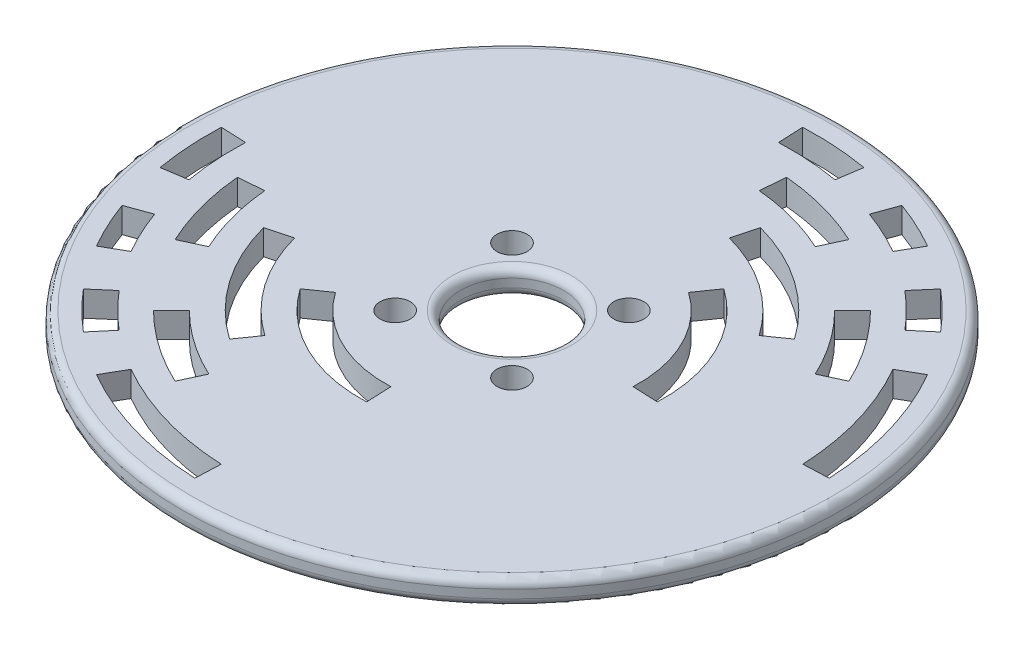
from build123d import *

# Parameters (mm, degrees)
SKETCH4_R           = 39
BOSS_EXTRUDE1_DEPTH = 3
CUT_EXTRUDE1_DEPTH  = 3
SKETCH1_R           = 6.096
SKETCH1_R_2         = 1.7859375
CUT_EXTRUDE3_DEPTH  = 3
FILLET1_R           = 1


with BuildPart() as part:
    # Sketch4 → Boss-Extrude1 (new body)
    with BuildSketch(Plane(origin=(0, 0, 0), x_dir=(1, 0, 0), z_dir=(0, 1, 0))):
        Circle(SKETCH4_R)
    extrude(amount=BOSS_EXTRUDE1_DEPTH)

    # Sketch3 → Cut-Extrude1 (cut)
    with BuildSketch(Plane(origin=(0, 0, 0), x_dir=(1, 0, 0), z_dir=(0, 1, 0))):
        with BuildLine():
            Line((32.968591312, 1.439439783), (35.965735977, 1.570297945))
            ThreePointArc((35.965735977, 1.570297945), (34.561794758, 10.073844505), (31.176914536, 18))
            Line((31.176914536, 18), (28.578838325, 16.5))
            ThreePointArc((28.578838325, 16.5), (31.681645195, 9.234357463), (32.968591312, 1.439439783))
        make_face()
        with BuildLine():
            Line((-1.570297945, 35.965735977), (-1.439439783, 32.968591312))
            ThreePointArc((-1.439439783, 32.968591312), (2.158303265, 32.929344467), (5.730389863, 32.498655849))
            Line((5.730389863, 32.498655849), (6.186823022, 35.464393705))
            ThreePointArc((6.186823022, 35.464393705), (2.321833751, 35.925048198), (-1.570297945, 35.965735977))
        make_face()
        with BuildLine():
            Line((12.31272516, 33.828934348), (11.28666473, 31.009856486))
            ThreePointArc((11.28666473, 31.009856486), (13.946402637, 29.908156972), (16.5, 28.578838325))
            Line((16.5, 28.578838325), (18, 31.176914536))
            ThreePointArc((18, 31.176914536), (15.214257423, 32.627080333), (12.31272516, 33.828934348))
        make_face()
        with BuildLine():
            Line((23.163459499, 27.558195587), (21.21199112, 25.279466623))
            ThreePointArc((21.21199112, 25.279466623), (23.334523779, 23.334523779), (25.279466623, 21.21199112))
            Line((25.279466623, 21.21199112), (27.577599952, 23.140353949))
            ThreePointArc((27.577599952, 23.140353949), (25.466509571, 25.445174203), (23.163459499, 27.558195587))
        make_face()
        with BuildLine():
            Line((-13.765834472, -19.659649063), (-12.045105163, -17.20219293))
            ThreePointArc((-12.045105163, -17.20219293), (-17.20219293, -12.045105163), (-20.284442352, -5.435199947))
            Line((-20.284442352, -5.435199947), (-23.182219831, -6.211657082))
            ThreePointArc((-23.182219831, -6.211657082), (-19.659649063, -13.765834472), (-13.765834472, -19.659649063))
        make_face()
        with BuildLine():
            Line((14.985723324, -0.65429081), (17.982867988, -0.785148973))
            ThreePointArc((17.982867988, -0.785148973), (16.143709348, 7.961196424), (10.324375854, 14.744736797))
            Line((10.324375854, 14.744736797), (8.603646545, 12.287280664))
            ThreePointArc((8.603646545, 12.287280664), (13.453091123, 6.634330353), (14.985723324, -0.65429081))
        make_face()
        with BuildLine():
            Line((-12.678547852, -27.189233611), (-11.410693067, -24.47031025))
            ThreePointArc((-11.410693067, -24.47031025), (-15.486563781, -22.117105196), (-19.091883092, -19.091883092))
            Line((-19.091883092, -19.091883092), (-21.213203436, -21.213203436))
            ThreePointArc((-21.213203436, -21.213203436), (-17.207293091, -24.574561329), (-12.678547852, -27.189233611))
        make_face()
        with BuildLine():
            Line((2.614672282, 29.885840943), (2.353205054, 26.897256848))
            ThreePointArc((2.353205054, 26.897256848), (6.988114218, 26.07999731), (11.410693067, 24.47031025))
            Line((11.410693067, 24.47031025), (12.678547852, 27.189233611))
            ThreePointArc((12.678547852, 27.189233611), (7.764571353, 28.977774789), (2.614672282, 29.885840943))
        make_face()
        with BuildLine():
            Line((21.213203436, 21.213203436), (19.091883092, 19.091883092))
            ThreePointArc((19.091883092, 19.091883092), (22.117105196, 15.486563781), (24.47031025, 11.410693067))
            Line((24.47031025, 11.410693067), (27.189233611, 12.678547852))
            ThreePointArc((27.189233611, 12.678547852), (24.574561329, 17.207293091), (21.213203436, 21.213203436))
        make_face()
        with BuildLine():
            Line((6.211657082, 23.182219831), (5.435199947, 20.284442352))
            ThreePointArc((5.435199947, 20.284442352), (12.045105163, 17.20219293), (17.20219293, 12.045105163))
            Line((17.20219293, 12.045105163), (19.659649063, 13.765834472))
            ThreePointArc((19.659649063, 13.765834472), (13.765834472, 19.659649063), (6.211657082, 23.182219831))
        make_face()
        with BuildLine():
            Line((-27.189233611, -12.678547852), (-24.47031025, -11.410693067))
            ThreePointArc((-24.47031025, -11.410693067), (-26.07999731, -6.988114218), (-26.897256848, -2.353205054))
            Line((-26.897256848, -2.353205054), (-29.885840943, -2.614672282))
            ThreePointArc((-29.885840943, -2.614672282), (-28.977774789, -7.764571353), (-27.189233611, -12.678547852))
        make_face()
        with BuildLine():
            Line((-14.744736797, -10.324375854), (-12.287280664, -8.603646545))
            ThreePointArc((-12.287280664, -8.603646545), (-6.634330353, -13.453091123), (0.65429081, -14.985723324))
            Line((0.65429081, -14.985723324), (0.785148973, -17.982867988))
            ThreePointArc((0.785148973, -17.982867988), (-7.961196424, -16.143709348), (-14.744736797, -10.324375854))
        make_face()
        with BuildLine():
            Line((-18, -31.176914536), (-16.5, -28.578838325))
            ThreePointArc((-16.5, -28.578838325), (-9.234357463, -31.681645195), (-1.439439783, -32.968591312))
            Line((-1.439439783, -32.968591312), (-1.570297945, -35.965735977))
            ThreePointArc((-1.570297945, -35.965735977), (-10.073844505, -34.561794758), (-18, -31.176914536))
        make_face()
        with BuildLine():
            Line((-23.140353949, -27.577599952), (-21.21199112, -25.279466623))
            ThreePointArc((-21.21199112, -25.279466623), (-23.334523779, -23.334523779), (-25.279466623, -21.21199112))
            Line((-25.279466623, -21.21199112), (-27.558195587, -23.163459499))
            ThreePointArc((-27.558195587, -23.163459499), (-25.445174203, -25.466509571), (-23.140353949, -27.577599952))
        make_face()
        with BuildLine():
            Line((-31.176914536, -18), (-28.578838325, -16.5))
            ThreePointArc((-28.578838325, -16.5), (-29.908156972, -13.946402637), (-31.009856486, -11.28666473))
            Line((-31.009856486, -11.28666473), (-33.828934348, -12.31272516))
            ThreePointArc((-33.828934348, -12.31272516), (-32.627080333, -15.214257423), (-31.176914536, -18))
        make_face()
        with BuildLine():
            Line((-35.464393705, -6.186823022), (-32.498655849, -5.730389863))
            ThreePointArc((-32.498655849, -5.730389863), (-32.929344467, -2.158303265), (-32.968591312, 1.439439783))
            Line((-32.968591312, 1.439439783), (-35.965735977, 1.570297945))
            ThreePointArc((-35.965735977, 1.570297945), (-35.925048198, -2.321833751), (-35.464393705, -6.186823022))
        make_face()
    extrude(amount=CUT_EXTRUDE1_DEPTH, mode=Mode.SUBTRACT)

    # Sketch1 → Cut-Extrude3 (cut)
    with BuildSketch(Plane(origin=(0, 0, 0), x_dir=(1, 0, 0), z_dir=(0, 1, 0))):
        Circle(SKETCH1_R)
        with Locations((6.914797213, 6.914797213)):
            Circle(SKETCH1_R_2)
        with Locations((6.914797213, -6.914797213)):
            Circle(SKETCH1_R_2)
        with Locations((-6.914797213, -6.914797213)):
            Circle(SKETCH1_R_2)
        with Locations((-6.914797213, 6.914797213)):
            Circle(SKETCH1_R_2)
    extrude(amount=CUT_EXTRUDE3_DEPTH, mode=Mode.SUBTRACT)

    # Fillet1
    fillet1_edges = [part.edges().sort_by_distance(p)[0] for p in [
        (-6.096, 0, 0),
        (-6.096, 3, 0),
        (-39, 3, 0),
        (-39, 0, 0),
    ]]
    fillet(fillet1_edges, radius=FILLET1_R)


solid = part.part
